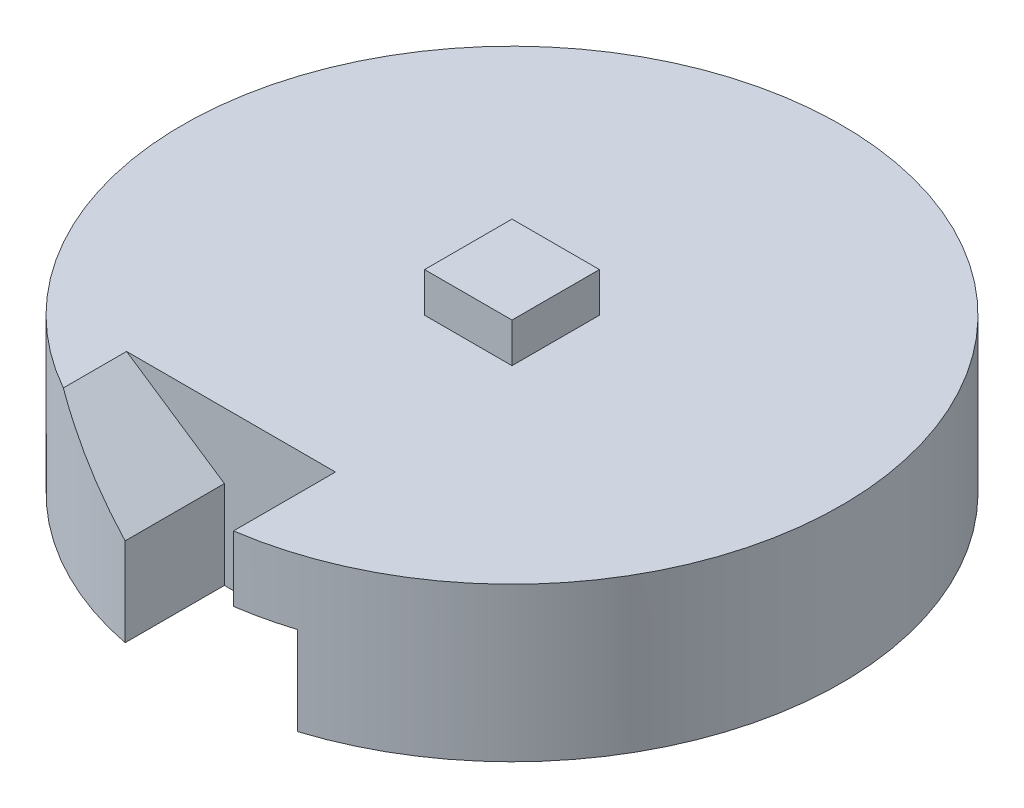
from build123d import *

# Parameters (mm, degrees)
SKETCH1_R           = 37.5
BOSS_EXTRUDE1_DEPTH = 17.5
CUT_EXTRUDE3_DEPTH  = 12
SKETCH9_W           = 9.95
SKETCH9_H           = 9.95
BOSS_EXTRUDE2_DEPTH = 22
SKETCH2_R           = 5
BOSS_EXTRUDE3_DEPTH = 10
CUT_EXTRUDE5_DEPTH  = 10
SKETCH12_R          = 3.025
CUT_EXTRUDE6_DEPTH  = 1.6


with BuildPart() as part:
    # Sketch1 → Boss-Extrude1 (new body)
    with BuildSketch(Plane(origin=(0, 0, 0), x_dir=(1, 0, 0), z_dir=(0, 1, 0))):
        Circle(SKETCH1_R)
    extrude(amount=BOSS_EXTRUDE1_DEPTH)

    # Sketch7 → Cut-Extrude3 (cut)
    with BuildSketch(Plane.XY.offset(37.5)):
        Polygon((5.409167976, 17.669921883), (-18.615329351, 17.669921883), (-7.232029952, 10.040131917), (-7.232029952, -0.186148413), (11.337754855, -0.186148413), (11.337754855, 10.05869391), (5.409167976, 10.05869391), align=None)
    extrude(amount=-CUT_EXTRUDE3_DEPTH, mode=Mode.SUBTRACT)

    # Sketch9 → Boss-Extrude2 (add)
    with BuildSketch(Plane(origin=(0, 0, 0), x_dir=(1, 0, 0), z_dir=(0, 1, 0))):
        Rectangle(SKETCH9_W, SKETCH9_H)
    extrude(amount=BOSS_EXTRUDE2_DEPTH)

    # Sketch2 → Boss-Extrude3 (add)
    with BuildSketch(Plane.XZ):
        Circle(SKETCH2_R)
    extrude(amount=BOSS_EXTRUDE3_DEPTH)

    # Sketch11 → Cut-Extrude5 (cut)
    with BuildSketch(Plane.XZ.offset(10)):
        with BuildLine():
            Line((0.018011531, -1.443232403), (0.565734089, -1.443232403))
            ThreePointArc((0.565734089, -1.443232403), (0.018011531, 1.556767597), (-0.529711026, -1.443232403))
            Line((-0.529711026, -1.443232403), (0.018011531, -1.443232403))
        make_face()
    extrude(amount=-CUT_EXTRUDE5_DEPTH, mode=Mode.SUBTRACT)

    # Sketch12 → Cut-Extrude6 (cut)
    with BuildSketch(Plane(origin=(0, 0, 0), x_dir=(-1, 0, 0), z_dir=(0, -1, 0))):
        with Locations((-30.018011531, -0.006767597)):
            Circle(SKETCH12_R)
        with Locations((29.981988469, -0.006767597)):
            Circle(SKETCH12_R)
    extrude(amount=-CUT_EXTRUDE6_DEPTH, mode=Mode.SUBTRACT)


solid = part.part
